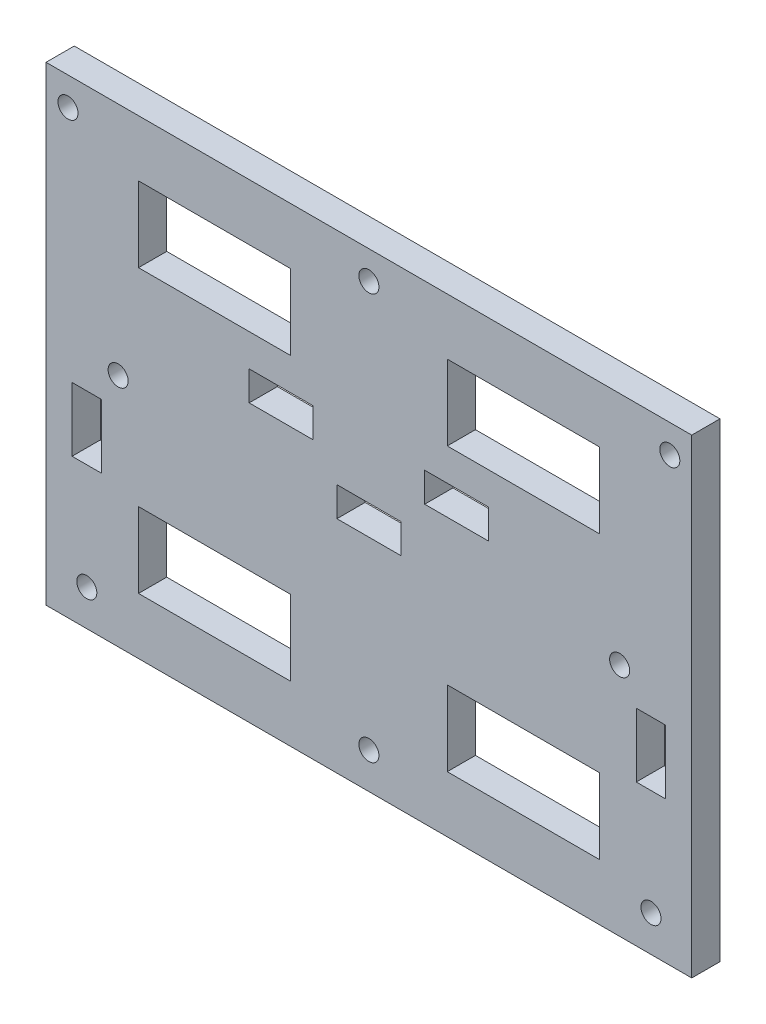
from build123d import *

# Parameters (mm, degrees)
SKETCH1_W           = 103
SKETCH1_H           = 75
SKETCH1_W_2         = 24.25
SKETCH1_H_2         = 12
BOSS_EXTRUDE1_DEPTH = 4.5
SKETCH2_R           = 1.6
SCREWHOLES_DEPTH    = 64.865092187
SKETCH3_W           = 10.2
SKETCH3_H           = 4.7
BELTCLAMP_DEPTH     = 64.865092187
SKETCH4_W           = 10.2
SKETCH4_H           = 4.7
CUT_EXTRUDE3_DEPTH  = 64.865092187
SKETCH5_R           = 1.6
SKETCH5_W           = 4.7
SKETCH5_H           = 10.2
CUT_EXTRUDE4_DEPTH  = 64.865092187


with BuildPart() as part:
    # Sketch1 → Boss-Extrude1 (new body)
    with BuildSketch(Plane.XY):
        Rectangle(SKETCH1_W, SKETCH1_H)
        with Locations((-24.625, 22.5)):
            Rectangle(SKETCH1_W_2, SKETCH1_H_2, mode=Mode.SUBTRACT)
        with Locations((24.625, 22.5)):
            Rectangle(SKETCH1_W_2, SKETCH1_H_2, mode=Mode.SUBTRACT)
        with Locations((24.625, -22.5)):
            Rectangle(SKETCH1_W_2, SKETCH1_H_2, mode=Mode.SUBTRACT)
        with Locations((-24.625, -22.5)):
            Rectangle(SKETCH1_W_2, SKETCH1_H_2, mode=Mode.SUBTRACT)
    extrude(amount=BOSS_EXTRUDE1_DEPTH)

    # Sketch2 → screwHoles (cut, through all)
    with BuildSketch(Plane.XY.offset(4.5)):
        with Locations((-48, 33)):
            Circle(SKETCH2_R)
        with Locations((48, 33)):
            Circle(SKETCH2_R)
        with Locations((40, 0)):
            Circle(SKETCH2_R)
        with Locations((-40, 0)):
            Circle(SKETCH2_R)
        with Locations((0, 33)):
            Circle(SKETCH2_R)
    extrude(amount=-SCREWHOLES_DEPTH, mode=Mode.SUBTRACT)

    # Sketch3 → BeltClamp (cut, through all)
    with BuildSketch(Plane.XY.offset(4.5)):
        with Locations((-14, 9)):
            Rectangle(SKETCH3_W, SKETCH3_H)
        with Locations((14, 9)):
            Rectangle(SKETCH3_W, SKETCH3_H)
    extrude(amount=-BELTCLAMP_DEPTH, mode=Mode.SUBTRACT)

    # Sketch4 → Cut-Extrude3 (cut, through all)
    with BuildSketch(Plane.XY.offset(4.5)):
        Rectangle(SKETCH4_W, SKETCH4_H)
    extrude(amount=-CUT_EXTRUDE3_DEPTH, mode=Mode.SUBTRACT)

    # Sketch5 → Cut-Extrude4 (cut, through all)
    with BuildSketch(Plane.XY.offset(4.5)):
        with Locations((45, -31.75)):
            Circle(SKETCH5_R)
        with Locations((-45, -31.75)):
            Circle(SKETCH5_R)
        with Locations((0, -31.75)):
            Circle(SKETCH5_R)
        with Locations((45, -9.75)):
            Rectangle(SKETCH5_W, SKETCH5_H)
        with Locations((-45, -9.75)):
            Rectangle(SKETCH5_W, SKETCH5_H)
    extrude(amount=-CUT_EXTRUDE4_DEPTH, mode=Mode.SUBTRACT)


solid = part.part
